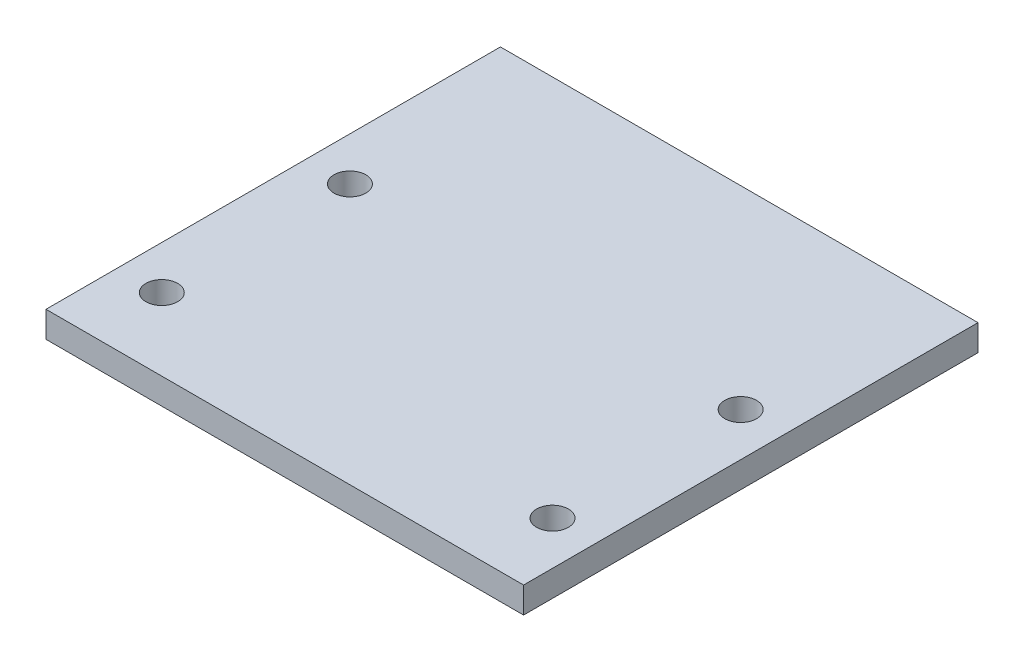
from build123d import *

# Parameters (mm, degrees)
SKETCH5_W      = 41.91
SKETCH5_H      = 39.878
SKETCH5_R      = 1.397
EXTRUDE3_DEPTH = 2.286


with BuildPart() as part:
    # Sketch5 → Extrude3 (new body)
    with BuildSketch(Plane(origin=(0, 0, 0), x_dir=(1, 0, 0), z_dir=(0, 1, 0))):
        with Locations((-20.955, -19.939)):
            Rectangle(SKETCH5_W, SKETCH5_H)
        with Locations((-38.1, -17.018)):
            Circle(SKETCH5_R, mode=Mode.SUBTRACT)
        with Locations((-38.1, -33.528)):
            Circle(SKETCH5_R, mode=Mode.SUBTRACT)
        with Locations((-3.81, -33.528)):
            Circle(SKETCH5_R, mode=Mode.SUBTRACT)
        with Locations((-3.81, -17.018)):
            Circle(SKETCH5_R, mode=Mode.SUBTRACT)
    extrude(amount=EXTRUDE3_DEPTH)


solid = part.part
